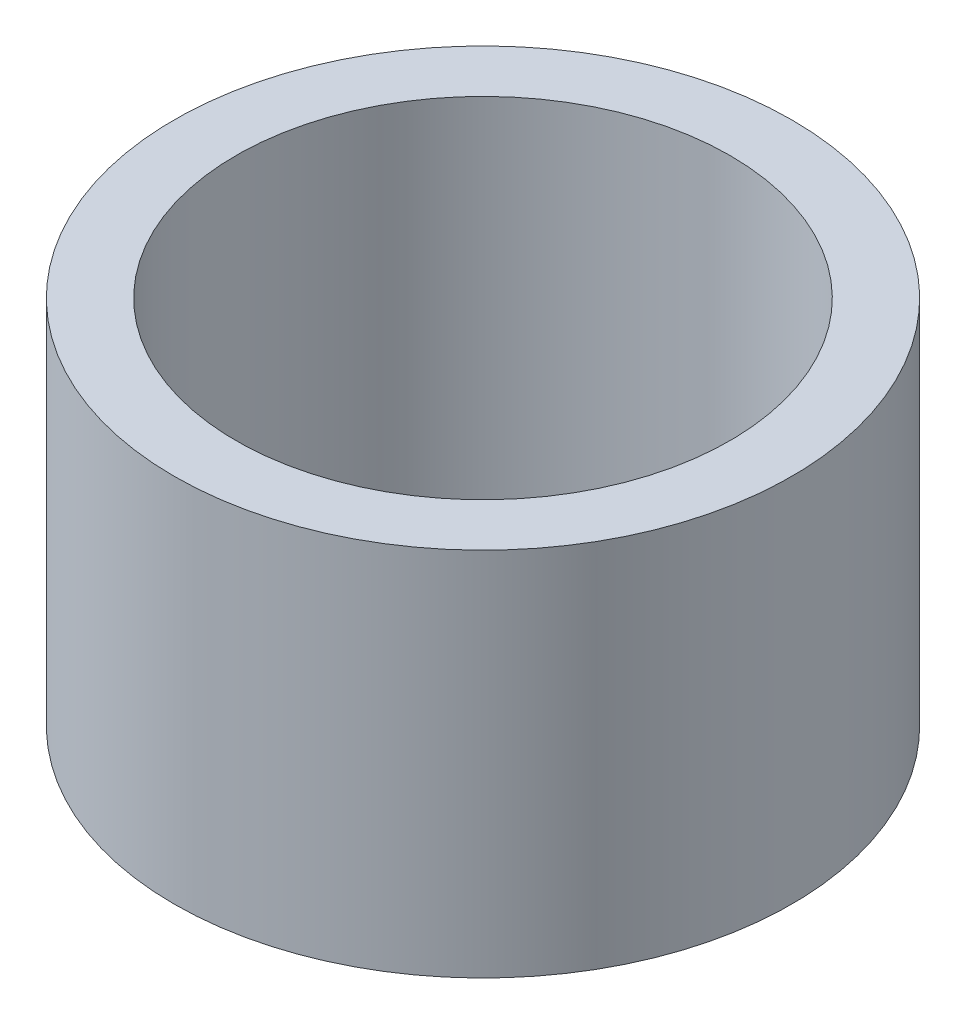
from build123d import *

# Parameters (mm, degrees)
SKETCH1_R           = 63.5
SKETCH1_R_2         = 50.8
BOSS_EXTRUDE1_DEPTH = 76.2


with BuildPart() as part:
    # Sketch1 → Boss-Extrude1 (new body)
    with BuildSketch(Plane(origin=(0, 0, 0), x_dir=(1, 0, 0), z_dir=(0, 1, 0))):
        Circle(SKETCH1_R)
        Circle(SKETCH1_R_2, mode=Mode.SUBTRACT)
    extrude(amount=BOSS_EXTRUDE1_DEPTH)


solid = part.part
